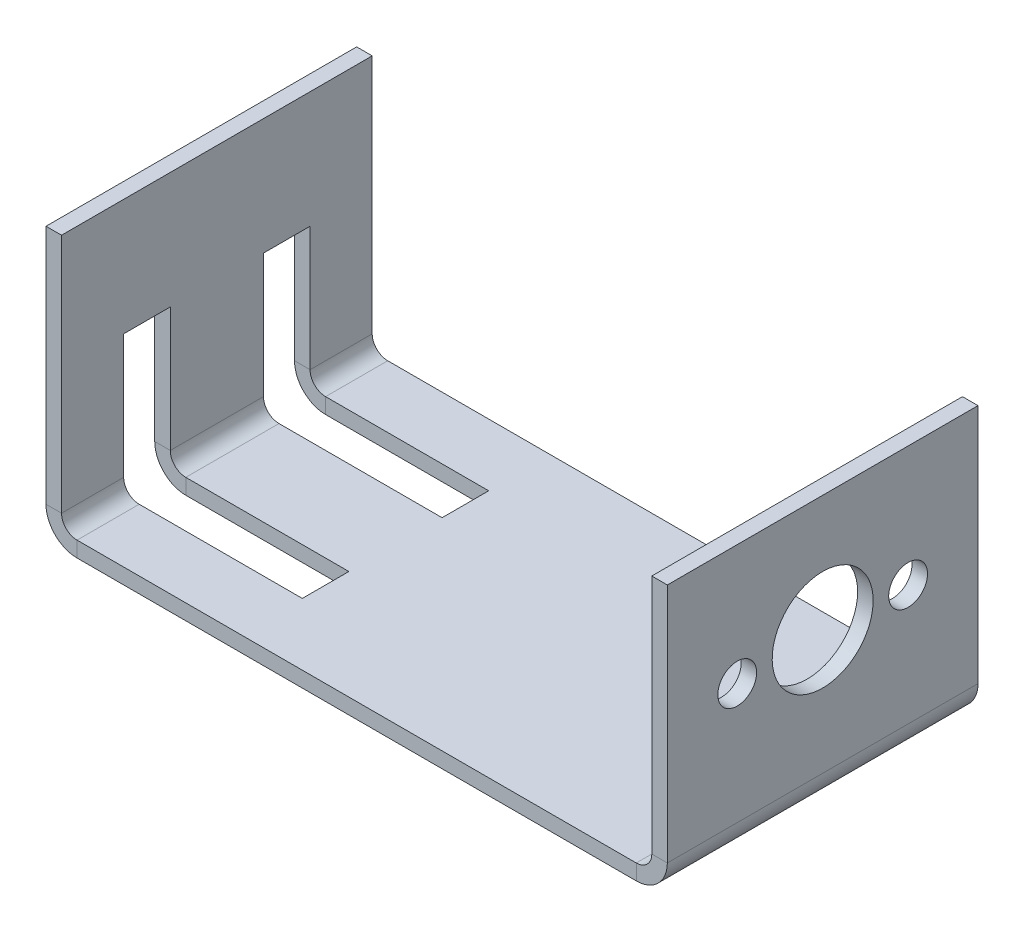
from build123d import *

# Parameters (mm, degrees)
SKETCH1_W                      = 80
SKETCH1_H                      = 40
BASE_FLANGE1_DEPTH             = 2
EDGE_FLANGE1_STRIP_W           = 12
EDGE_FLANGE1_STRIP_H           = 2
EDGE_FLANGE1_STRIP_CUT_DEPTH   = 40
EDGE_FLANGE1_STRIP_2_W         = 12
EDGE_FLANGE1_STRIP_2_H         = 2
EDGE_FLANGE1_STRIP_CUT_2_DEPTH = 40
EDGE_FLANGE1_DEPTH             = 40
EDGE_FLANGE1_BEND_DEPTH        = 40
SKETCH14_R                     = 6.5
SKETCH14_R_2                   = 2.5
CUT_EXTRUDE1_DEPTH             = 10
SKETCH15_W                     = 6
SKETCH15_H                     = 32
CUT_EXTRUDE2_DEPTH             = 25


# Sheet-metal steps are written as plain solids
with BuildPart() as part:
    # Sketch1 → Base-Flange1 (new body)
    with BuildSketch(Plane(origin=(0, 0, 0), x_dir=(1, 0, 0), z_dir=(0, 1, 0))):
        Rectangle(SKETCH1_W, SKETCH1_H)
    extrude(amount=-BASE_FLANGE1_DEPTH)

    # Edge-Flange1 strip (across the edge) → Edge-Flange1 strip cut (cut)
    with BuildSketch(Plane(origin=(40, 0, 20), x_dir=(-1, 0, 0), z_dir=(0, 0, -1))):
        with Locations((-2, -1)):
            Rectangle(EDGE_FLANGE1_STRIP_W, EDGE_FLANGE1_STRIP_H)
    extrude(amount=EDGE_FLANGE1_STRIP_CUT_DEPTH, mode=Mode.SUBTRACT)

    # Edge-Flange1 strip 2 (across the edge) → Edge-Flange1 strip cut 2 (cut)
    with BuildSketch(Plane(origin=(-40, 0, -20), x_dir=(1, 0, 0), z_dir=(0, 0, 1))):
        with Locations((-2, -1)):
            Rectangle(EDGE_FLANGE1_STRIP_2_W, EDGE_FLANGE1_STRIP_2_H)
    extrude(amount=EDGE_FLANGE1_STRIP_CUT_2_DEPTH, mode=Mode.SUBTRACT)

    # Edge-Flange1 section (across the edge) → Edge-Flange1 (add)
    with BuildSketch(Plane(origin=(40, 0, 20), x_dir=(-1, 0, 0), z_dir=(0, 0, -1))):
        with BuildLine():
            Line((0, 2), (0, 33))
            Line((0, 33), (2, 33))
            Line((2, 33), (2, 2))
            ThreePointArc((2, 2), (2.585786438, 0.585786438), (4, 0))
            Line((4, 0), (4, -2))
            ThreePointArc((4, -2), (1.171572875, -0.828427125), (0, 2))
        make_face()
    extrude(amount=EDGE_FLANGE1_DEPTH)

    # Edge-Flange1 section 2 (across the edge) → Edge-Flange1 bend (add)
    with BuildSketch(Plane(origin=(-40, 0, -20), x_dir=(1, 0, 0), z_dir=(0, 0, 1))):
        with BuildLine():
            Line((0, 2), (0, 33))
            Line((0, 33), (2, 33))
            Line((2, 33), (2, 2))
            ThreePointArc((2, 2), (2.585786438, 0.585786438), (4, 0))
            Line((4, 0), (4, -2))
            ThreePointArc((4, -2), (1.171572875, -0.828427125), (0, 2))
        make_face()
    extrude(amount=EDGE_FLANGE1_BEND_DEPTH)

    # Sketch14 → Cut-Extrude1 (cut)
    with BuildSketch(Plane(origin=(40, 0, 0), x_dir=(0, 0, -1), z_dir=(1, 0, 0))):
        with Locations(Location((0, 18, 0), (0, 0, 90))):
            Circle(SKETCH14_R)
        with Locations(Location((11, 17.5, 0), (0, 0, 90))):
            Circle(SKETCH14_R_2)
        with Locations(Location((-11, 17.5, 0), (0, 0, 270))):
            Circle(SKETCH14_R_2)
    extrude(amount=-CUT_EXTRUDE1_DEPTH, mode=Mode.SUBTRACT)

    # Sketch15 → Cut-Extrude2 (cut)
    with BuildSketch(Plane.ZY.offset(40)):
        with Locations((-9, 2)):
            Rectangle(SKETCH15_W, SKETCH15_H)
        with Locations((9, 2)):
            Rectangle(SKETCH15_W, SKETCH15_H)
    extrude(amount=-CUT_EXTRUDE2_DEPTH, mode=Mode.SUBTRACT)


solid = part.part
